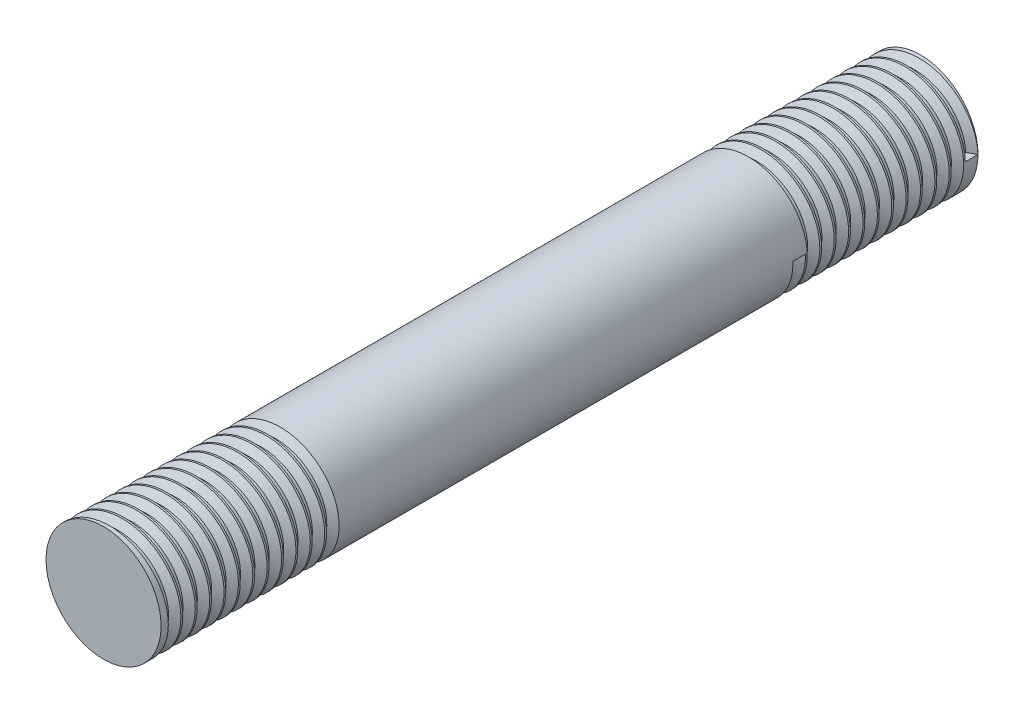
from build123d import *

# Parameters (mm, degrees)
SZKIC1_R                    = 10
DODANIE_WYCI_GNI_CIE1_DEPTH = 142
GWINT1_PITCH                = 2.5
GWINT2_PITCH                = 2.5


with BuildPart() as part:
    # Szkic1 → Dodanie-wyciągnięcie1 (new body)
    with BuildSketch(Plane.XY):
        Circle(SZKIC1_R)
    extrude(amount=DODANIE_WYCI_GNI_CIE1_DEPTH)

    # Gwint1: the profile of Profil gwintu1 profile screwed along a right-hand helix of 12 turns, 10 arcs to a turn; built about Z, then put on its axis
    gwint1_z = Axis((0, 0, 0), (0, 0, 1))
    gwint1_corners = [(10.0003, 0, -0.000173205), (10.0003, 0, 2.187673198), (8.646835312, 0, 1.406249997), (8.646835312, 0, 0.781249997)]
    with BuildLine(mode=Mode.PRIVATE) as gwint1_profile:
        Line(gwint1_corners[0], gwint1_corners[1])
        Line(gwint1_corners[1], gwint1_corners[2])
        Line(gwint1_corners[2], gwint1_corners[3])
        Line(gwint1_corners[3], gwint1_corners[0])
    gwint1_cap = Face(gwint1_profile.wire())
    gwint1_turn_angles = [0, 18, 36, 54, 72, 90, 108, 126, 144, 162, 180, 198, 216, 234, 252, 270, 288, 306, 324, 342, 360]
    gwint1_turn_weights = [1, 0.9510565162951535, 1, 0.9510565162951535, 1, 0.9510565162951535, 1, 0.9510565162951535, 1, 0.9510565162951535, 1, 0.9510565162951535, 1, 0.9510565162951535, 1, 0.9510565162951535, 1, 0.9510565162951535, 1, 0.9510565162951535, 1]
    gwint1_turn_rails = [Edge.make_bspline([Vector(p[0], p[1], 0).rotate(gwint1_z, gwint1_turn_angles[k]) / gwint1_turn_weights[k] + Vector(0, 0, p[2] + GWINT1_PITCH * gwint1_turn_angles[k] / 360) for k in range(21)], [0, 0, 0, 1, 1, 2, 2, 3, 3, 4, 4, 5, 5, 6, 6, 7, 7, 8, 8, 9, 9, 10, 10, 10], 2, gwint1_turn_weights) for p in gwint1_corners]
    gwint1_turn_sides = [Face.make_surface_from_curves(gwint1_turn_rails[p[0]], gwint1_turn_rails[p[1]]) for p in [(0, 1), (1, 2), (2, 3), (3, 0)]]
    gwint1 = Plane(origin=(0, 0, 0), x_dir=(1, 0, 0), z_dir=(0, 0, 1)) * Solid(Shell([*[p.moved(Location((0, 0, GWINT1_PITCH * i))) for i in range(12) for p in gwint1_turn_sides], gwint1_cap, gwint1_cap.rotate(gwint1_z, 4320).moved(Location((0, 0, GWINT1_PITCH * 4320 / 360)))]))
    add(gwint1, mode=Mode.SUBTRACT)

    # Gwint2: the profile of Profil gwintu2 profile screwed along a right-hand helix of 12 turns, 10 arcs to a turn; built about Z, then put on its axis
    gwint2_z = Axis((0, 0, 0), (0, 0, 1))
    gwint2_corners = [(10.0003, 0, -0.000173205), (10.0003, 0, 2.187673198), (8.646835312, 0, 1.406249997), (8.646835312, 0, 0.781249997)]
    with BuildLine(mode=Mode.PRIVATE) as gwint2_profile:
        Line(gwint2_corners[0], gwint2_corners[1])
        Line(gwint2_corners[1], gwint2_corners[2])
        Line(gwint2_corners[2], gwint2_corners[3])
        Line(gwint2_corners[3], gwint2_corners[0])
    gwint2_cap = Face(gwint2_profile.wire())
    gwint2_turn_angles = [0, 18, 36, 54, 72, 90, 108, 126, 144, 162, 180, 198, 216, 234, 252, 270, 288, 306, 324, 342, 360]
    gwint2_turn_weights = [1, 0.9510565162951535, 1, 0.9510565162951535, 1, 0.9510565162951535, 1, 0.9510565162951535, 1, 0.9510565162951535, 1, 0.9510565162951535, 1, 0.9510565162951535, 1, 0.9510565162951535, 1, 0.9510565162951535, 1, 0.9510565162951535, 1]
    gwint2_turn_rails = [Edge.make_bspline([Vector(p[0], p[1], 0).rotate(gwint2_z, gwint2_turn_angles[k]) / gwint2_turn_weights[k] + Vector(0, 0, p[2] + GWINT2_PITCH * gwint2_turn_angles[k] / 360) for k in range(21)], [0, 0, 0, 1, 1, 2, 2, 3, 3, 4, 4, 5, 5, 6, 6, 7, 7, 8, 8, 9, 9, 10, 10, 10], 2, gwint2_turn_weights) for p in gwint2_corners]
    gwint2_turn_sides = [Face.make_surface_from_curves(gwint2_turn_rails[p[0]], gwint2_turn_rails[p[1]]) for p in [(0, 1), (1, 2), (2, 3), (3, 0)]]
    gwint2 = Plane(origin=(0, 0, 142), x_dir=(-1, 0, 0), z_dir=(0, 0, -1)) * Solid(Shell([*[p.moved(Location((0, 0, GWINT2_PITCH * i))) for i in range(12) for p in gwint2_turn_sides], gwint2_cap, gwint2_cap.rotate(gwint2_z, 4320).moved(Location((0, 0, GWINT2_PITCH * 4320 / 360)))]))
    add(gwint2, mode=Mode.SUBTRACT)


solid = part.part
